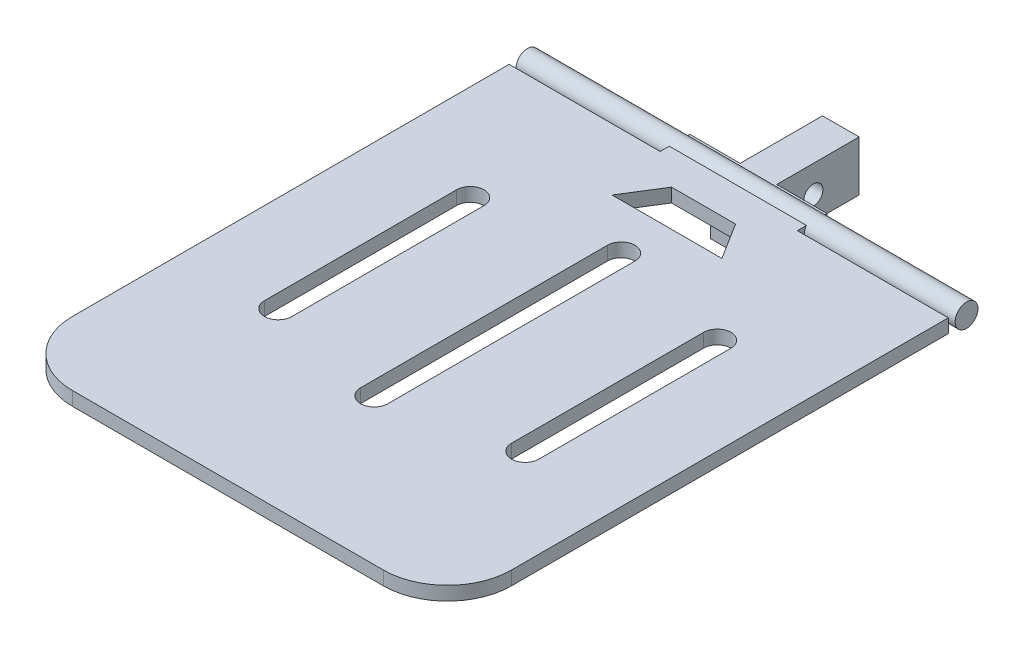
from build123d import *

# Parameters (mm, degrees)
F_01_PLATE_BODY_DEPTH   = 1.5
SKETCH_2_R              = 2.5
F_02_EDGE_BEAD_D5_DEPTH = 48
SKETCH_3_W              = 30
SKETCH_3_H              = 8
F_03_WEB_DEPTH          = 1.5
SKETCH_4_W              = 8
SKETCH_4_H              = 24.5
F_04_TAB_DEPTH          = 5.5
F_05_SLOT_1_F_DEPTH     = 134.305101178
F_05_SLOT_1_B_DEPTH     = 134.305101178
F_05_SLOT_2_F_DEPTH     = 134.305101178
F_05_SLOT_2_B_DEPTH     = 134.305101178
F_05_SLOT_3_F_DEPTH     = 134.305101178
F_05_SLOT_3_B_DEPTH     = 134.305101178
F_06_WINDOW_F_DEPTH     = 134.305101178
F_06_WINDOW_B_DEPTH     = 134.305101178
SKETCH_13_R             = 2.1
F_07_PINHOLE_R_DEPTH    = 134.150291025
SKETCH_14_R             = 2.1
F_07_PINHOLE_L_DEPTH    = 134.150291025


with BuildPart() as part:
    # 草图1 → 01_PLATE_BODY (new, symmetric)
    with BuildSketch(Plane(origin=(0, 4.5, 0), x_dir=(1, 0, 0), z_dir=(0, 1, 0))):
        with BuildLine():
            Line((-48, -14.5), (48, -14.5))
            Line((48, -14.5), (48, -110))
            ThreePointArc((48, -110), (43.899494937, -119.899494937), (34, -124))
            Line((34, -124), (-34, -124))
            ThreePointArc((-34, -124), (-43.899494937, -119.899494937), (-48, -110))
            Line((-48, -110), (-48, -14.5))
        make_face()
    extrude(amount=F_01_PLATE_BODY_DEPTH, both=True)



with BuildPart() as body_2:
    # 草图2 → 02_EDGE_BEAD_D5 (new, symmetric)
    with BuildSketch(Plane(origin=(0, 0, 0), x_dir=(0, 0, -1), z_dir=(1, 0, 0))):
        with Locations((-10.5, 4.5)):
            Circle(SKETCH_2_R)
    extrude(amount=F_02_EDGE_BEAD_D5_DEPTH, both=True)


with BuildPart() as part_1:
    add(part.part)

    add(body_2.part)  # 03_WEB merges body 2
    # 草图3 → 03_WEB (add, symmetric)
    with BuildSketch(Plane(origin=(0, 4.5, 0), x_dir=(1, 0, 0), z_dir=(0, 1, 0))):
        with Locations((0, -12)):
            Rectangle(SKETCH_3_W, SKETCH_3_H)
    extrude(amount=F_03_WEB_DEPTH, both=True)

    # 草图4 → 04_TAB (add, symmetric)
    with BuildSketch(Plane(origin=(0, 0.5, 0), x_dir=(1, 0, 0), z_dir=(0, 1, 0))):
        with Locations((0, -2.25)):
            Rectangle(SKETCH_4_W, SKETCH_4_H)
    extrude(amount=F_04_TAB_DEPTH, both=True)

    # 草图5 → 05_SLOT_1_F (cut, through all)
    with BuildSketch(Plane(origin=(0, 4.5, 0), x_dir=(1, 0, 0), z_dir=(0, 1, 0))):
        with BuildLine():
            Line((3, -38), (3, -92))
            ThreePointArc((3, -92), (0, -95), (-3, -92))
            Line((-3, -92), (-3, -38))
            ThreePointArc((-3, -38), (0, -35), (3, -38))
        make_face()
    extrude(amount=F_05_SLOT_1_F_DEPTH, mode=Mode.SUBTRACT)

    # 草图6 → 05_SLOT_1_B (cut, through all)
    with BuildSketch(Plane(origin=(0, 4.5, 0), x_dir=(1, 0, 0), z_dir=(0, 1, 0))):
        with BuildLine():
            Line((3, -38), (3, -92))
            ThreePointArc((3, -92), (0, -95), (-3, -92))
            Line((-3, -92), (-3, -38))
            ThreePointArc((-3, -38), (0, -35), (3, -38))
        make_face()
    extrude(amount=-F_05_SLOT_1_B_DEPTH, mode=Mode.SUBTRACT)

    # 草图7 → 05_SLOT_2_F (cut, through all)
    with BuildSketch(Plane(origin=(0, 4.5, 0), x_dir=(1, 0, 0), z_dir=(0, 1, 0))):
        with BuildLine():
            Line((-24, -44), (-24, -86))
            ThreePointArc((-24, -86), (-27, -89), (-30, -86))
            Line((-30, -86), (-30, -44))
            ThreePointArc((-30, -44), (-27, -41), (-24, -44))
        make_face()
    extrude(amount=F_05_SLOT_2_F_DEPTH, mode=Mode.SUBTRACT)

    # 草图8 → 05_SLOT_2_B (cut, through all)
    with BuildSketch(Plane(origin=(0, 4.5, 0), x_dir=(1, 0, 0), z_dir=(0, 1, 0))):
        with BuildLine():
            Line((-24, -44), (-24, -86))
            ThreePointArc((-24, -86), (-27, -89), (-30, -86))
            Line((-30, -86), (-30, -44))
            ThreePointArc((-30, -44), (-27, -41), (-24, -44))
        make_face()
    extrude(amount=-F_05_SLOT_2_B_DEPTH, mode=Mode.SUBTRACT)

    # 草图9 → 05_SLOT_3_F (cut, through all)
    with BuildSketch(Plane(origin=(0, 4.5, 0), x_dir=(1, 0, 0), z_dir=(0, 1, 0))):
        with BuildLine():
            Line((30, -44), (30, -86))
            ThreePointArc((30, -86), (27, -89), (24, -86))
            Line((24, -86), (24, -44))
            ThreePointArc((24, -44), (27, -41), (30, -44))
        make_face()
    extrude(amount=F_05_SLOT_3_F_DEPTH, mode=Mode.SUBTRACT)

    # 草图10 → 05_SLOT_3_B (cut, through all)
    with BuildSketch(Plane(origin=(0, 4.5, 0), x_dir=(1, 0, 0), z_dir=(0, 1, 0))):
        with BuildLine():
            Line((30, -44), (30, -86))
            ThreePointArc((30, -86), (27, -89), (24, -86))
            Line((24, -86), (24, -44))
            ThreePointArc((24, -44), (27, -41), (30, -44))
        make_face()
    extrude(amount=-F_05_SLOT_3_B_DEPTH, mode=Mode.SUBTRACT)

    # 草图11 → 06_WINDOW_F (cut, through all)
    with BuildSketch(Plane(origin=(0, 4.5, 0), x_dir=(1, 0, 0), z_dir=(0, 1, 0))):
        Polygon((-7, -20), (7, -20), (12, -28), (-12, -28), align=None)
    extrude(amount=F_06_WINDOW_F_DEPTH, mode=Mode.SUBTRACT)

    # 草图12 → 06_WINDOW_B (cut, through all)
    with BuildSketch(Plane(origin=(0, 4.5, 0), x_dir=(1, 0, 0), z_dir=(0, 1, 0))):
        Polygon((-7, -20), (7, -20), (12, -28), (-12, -28), align=None)
    extrude(amount=-F_06_WINDOW_B_DEPTH, mode=Mode.SUBTRACT)

    # 草图13 → 07_PINHOLE_R (cut, through all)
    with BuildSketch(Plane(origin=(0, 0, 0), x_dir=(0, 0, -1), z_dir=(1, 0, 0))):
        Circle(SKETCH_13_R)
    extrude(amount=F_07_PINHOLE_R_DEPTH, mode=Mode.SUBTRACT)

    # 草图14 → 07_PINHOLE_L (cut, through all)
    with BuildSketch(Plane(origin=(0, 0, 0), x_dir=(0, 0, -1), z_dir=(1, 0, 0))):
        Circle(SKETCH_14_R)
    extrude(amount=-F_07_PINHOLE_L_DEPTH, mode=Mode.SUBTRACT)


solid = part_1.part
